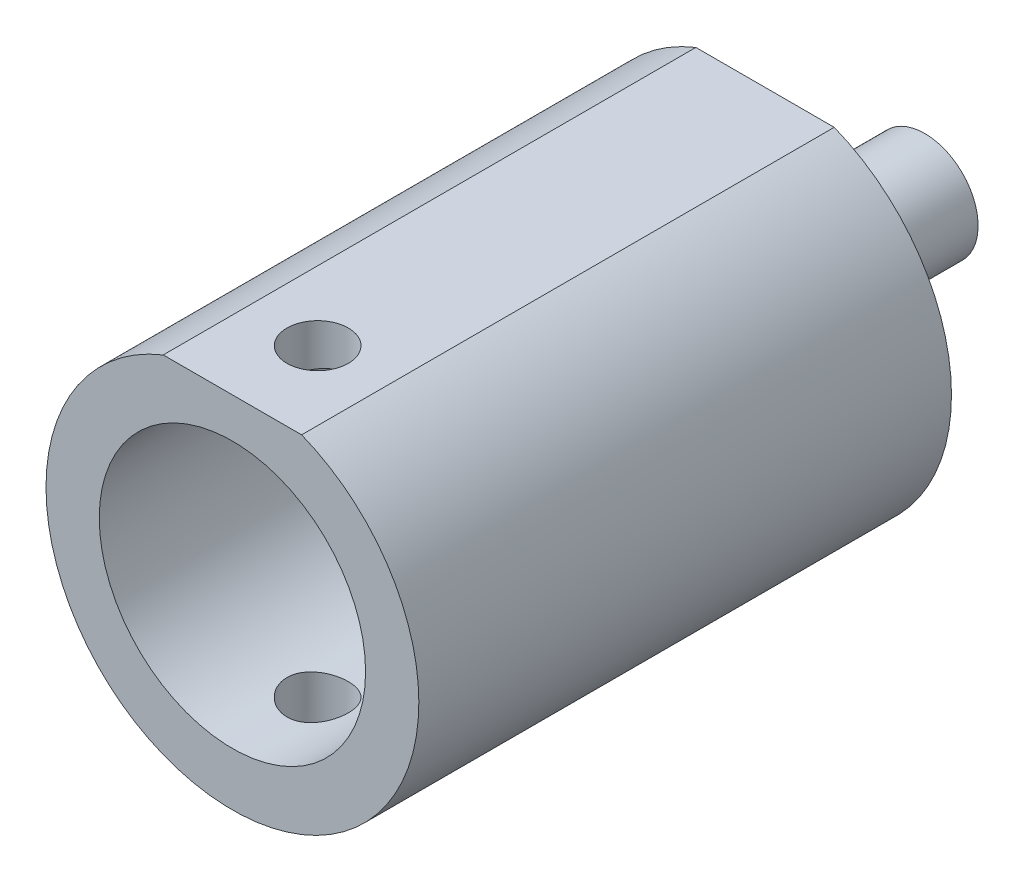
from build123d import *

# Parameters (mm, degrees)
F_5_8_0_625_DIAMETER_HOLE1_D     = 15.875
F_5_8_0_625_DIAMETER_HOLE1_DEPTH = 25.4
F_5_8_0_625_DIAMETER_HOLE1_TIP   = 4.769331164
CUT_EXTRUDE1_DEPTH               = 45.165608085
CUT_EXTRUDE1_DEPTH_BACK          = 45.165608085
SKETCH3_W                        = 31.75
SKETCH3_H                        = 0.79375
F_6_CLEARANCE_HOLE1_D            = 3.6576


with BuildPart() as part:
    # Sketch1 → Revolve1 (revolve)
    with BuildSketch(Plane(origin=(0, 0, 0), x_dir=(1, 0, 0), z_dir=(0, 1, 0))):
        Polygon((0, 0), (7.9375, 0), (11.1125, 0), (11.1125, 31.75), (3.175, 31.75), (3.175, 41.275), (0, 41.275), (0, 25.4), align=None)
    revolve(axis=Axis((0, 0, -25.4), (0, 0, 1)))

    # 5/8 (0.625) Diameter Hole1
    with Locations(Plane.XY):
        with Locations((0, 0)):
            Hole(F_5_8_0_625_DIAMETER_HOLE1_D / 2, depth=F_5_8_0_625_DIAMETER_HOLE1_DEPTH)
            with Locations((0, 0, -(F_5_8_0_625_DIAMETER_HOLE1_DEPTH + F_5_8_0_625_DIAMETER_HOLE1_TIP / 2))):  # 118° drill point
                Cone(0, F_5_8_0_625_DIAMETER_HOLE1_D / 2, F_5_8_0_625_DIAMETER_HOLE1_TIP, mode=Mode.SUBTRACT)

    # Sketch3 → Cut-Extrude1 (cut, two sides: drawn at the far end of the back side and taken through both)
    with BuildSketch(Plane(origin=(0, 0, 0), x_dir=(0, 0, -1), z_dir=(1, 0, 0)).offset(-CUT_EXTRUDE1_DEPTH_BACK)):
        with Locations((15.875, 10.715625)):
            Rectangle(SKETCH3_W, SKETCH3_H)
    extrude(amount=CUT_EXTRUDE1_DEPTH + CUT_EXTRUDE1_DEPTH_BACK, mode=Mode.SUBTRACT)

    # #6 Clearance Hole1 (through all)
    with Locations(Plane(origin=(0, 10.31875, 0), x_dir=(1, 0, 0), z_dir=(0, 1, 0))):
        with Locations((0, 5.08)):
            Hole(F_6_CLEARANCE_HOLE1_D / 2)


solid = part.part
